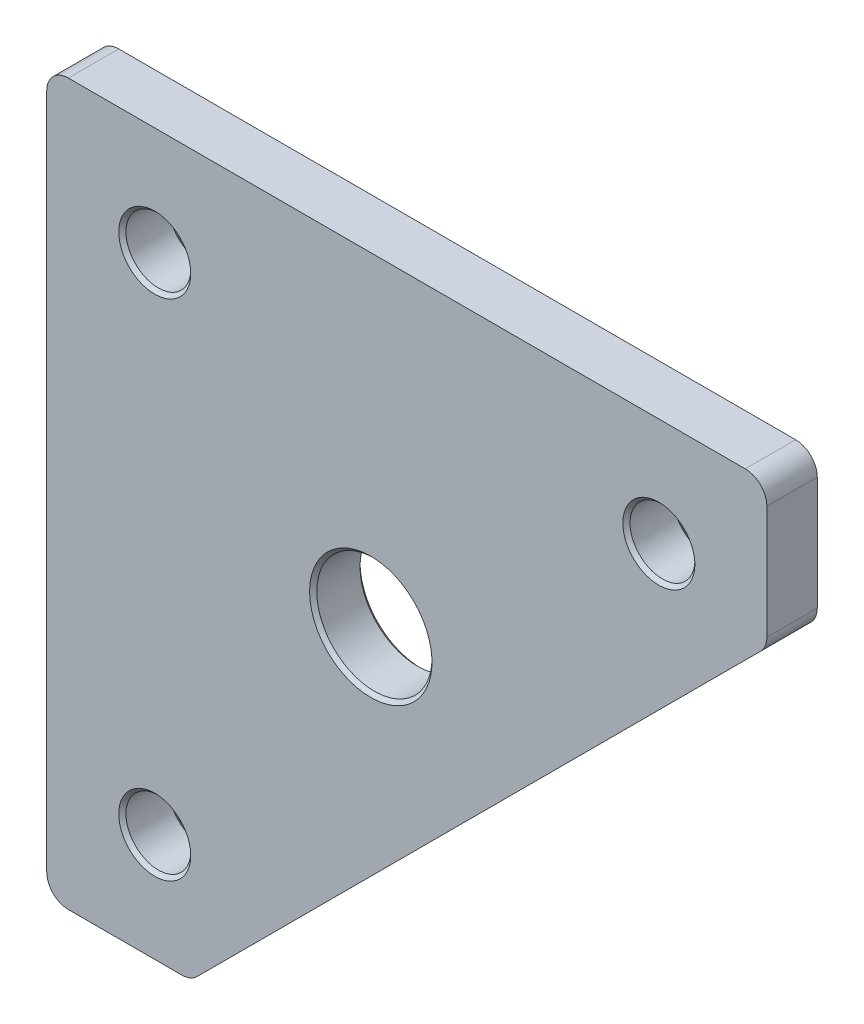
from build123d import *

# Parameters (mm, degrees)
BOSS_EXTRUDE1_DEPTH        = 7
F_9_0_9_DIAMETER_HOLE1_D   = 9
F_16_0_16_DIAMETER_HOLE1_D = 16
F_9_0_9_DIAMETER_HOLE2_D   = 9
CHAMFER1_SIZE              = 0.5
FILLET1_R                  = 3


with BuildPart() as part:
    # Sketch1 → Boss-Extrude1 (new body)
    with BuildSketch(Plane(origin=(0, 0, 0), x_dir=(-1, 0, 0), z_dir=(0, 0, -1))):
        Polygon((0, 0), (-100, 0), (-100, -20), (-20, -100), (0, -100), align=None)
    extrude(amount=-BOSS_EXTRUDE1_DEPTH)

    # Ø9.0 (9) Diameter Hole1 (through all)
    with Locations(Plane.XY.offset(7)):
        with Locations((85, -15), (15, -15)):
            Hole(F_9_0_9_DIAMETER_HOLE1_D / 2)

    # Ø16.0 (16) Diameter Hole1 (through all)
    with Locations(Plane.XY.offset(7)):
        with Locations((45, -45)):
            Hole(F_16_0_16_DIAMETER_HOLE1_D / 2)

    # Ø9.0 (9) Diameter Hole2 (through all)
    with Locations(Plane(origin=(0, 0, 0), x_dir=(-1, 0, 0), z_dir=(0, 0, -1))):
        with Locations((-15, -85)):
            Hole(F_9_0_9_DIAMETER_HOLE2_D / 2)

    # Chamfer1
    chamfer1_edges = [part.edges().sort_by_distance(p)[0] for p in [
        (89.5, -15, 0),
        (10.5, -85, 7),
        (53, -45, 0),
        (10.5, -85, 0),
        (19.5, -15, 0),
        (19.5, -15, 7),
        (53, -45, 7),
        (89.5, -15, 7),
    ]]
    chamfer(chamfer1_edges, length=CHAMFER1_SIZE)

    # Fillet1
    fillet1_edges = [part.edges().sort_by_distance(p)[0] for p in [
        (0, -100, 3.5),
        (0, 0, 3.5),
        (20, -100, 3.5),
        (100, -20, 3.5),
        (100, 0, 3.5),
    ]]
    fillet(fillet1_edges, radius=FILLET1_R)


solid = part.part
